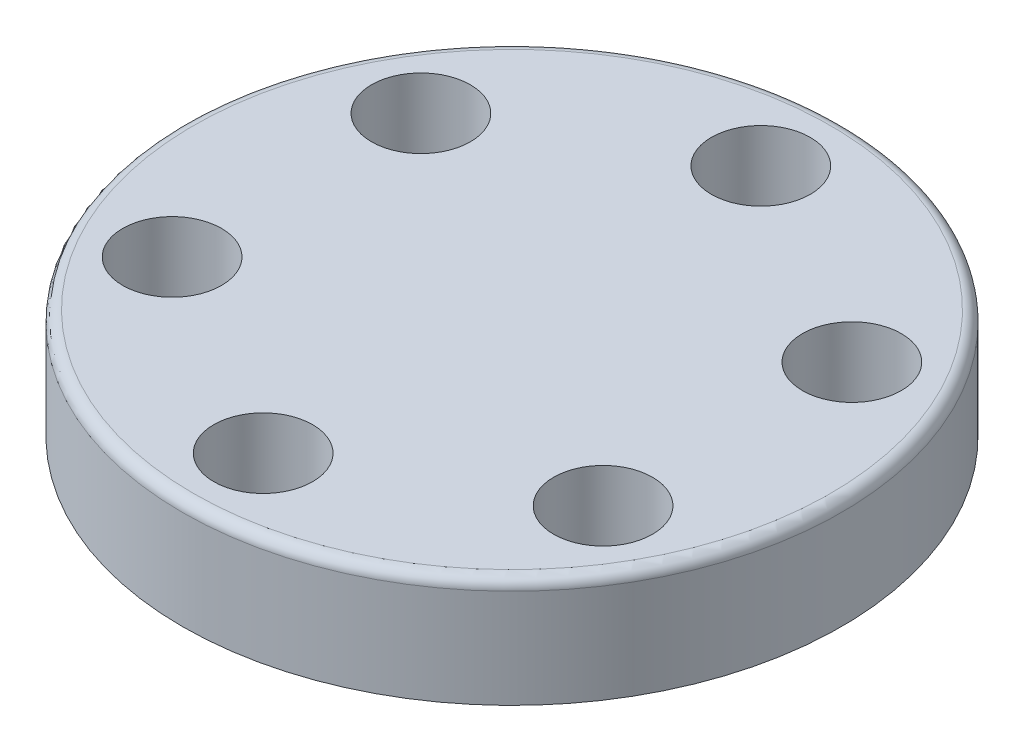
from build123d import *

# Parameters (mm, degrees)
SKETCH_1_R      = 30
SKETCH_1_R_2    = 4.5
EXTRUDE_2_DEPTH = 10
SKETCH_3_R      = 4.5
SKETCH_3_R_2    = 2.5
EXTRUDE_3_DEPTH = 3
FILLET_1_R      = 1


with BuildPart() as part:
    # ｽｹｯﾁ1 → ﾎﾞｽ - 押し出し2 (new body)
    with BuildSketch(Plane(origin=(0, 0, 0), x_dir=(1, 0, 0), z_dir=(0, 1, 0))):
        Circle(SKETCH_1_R)
        with Locations((0, -22.65)):
            Circle(SKETCH_1_R_2, mode=Mode.SUBTRACT)
        with Locations((-19.615475396, -11.325)):
            Circle(SKETCH_1_R_2, mode=Mode.SUBTRACT)
        with Locations((-19.615475396, 11.325)):
            Circle(SKETCH_1_R_2, mode=Mode.SUBTRACT)
        with Locations((0, 22.65)):
            Circle(SKETCH_1_R_2, mode=Mode.SUBTRACT)
        with Locations((19.615475396, 11.325)):
            Circle(SKETCH_1_R_2, mode=Mode.SUBTRACT)
        with Locations((19.615475396, -11.325)):
            Circle(SKETCH_1_R_2, mode=Mode.SUBTRACT)
    extrude(amount=EXTRUDE_2_DEPTH)

    # ｽｹｯﾁ3 → ﾎﾞｽ - 押し出し3 (add)
    # profile 1 of 6: a face of its own
    with BuildSketch(Plane.XZ):
        with Locations((-19.615475396, -11.325)):
            Circle(SKETCH_3_R)
        with Locations((-19.615475396, -11.325)):
            Circle(SKETCH_3_R_2, mode=Mode.SUBTRACT)
    # profile 2 of 6: a face of its own
    with BuildSketch(Plane.XZ):
        with Locations((-19.615475396, 11.325)):
            Circle(SKETCH_3_R)
        with Locations((-19.615475396, 11.325)):
            Circle(SKETCH_3_R_2, mode=Mode.SUBTRACT)
    # profile 3 of 6: a face of its own
    with BuildSketch(Plane.XZ):
        with Locations((0, 22.65)):
            Circle(SKETCH_3_R)
        with Locations((0, 22.65)):
            Circle(SKETCH_3_R_2, mode=Mode.SUBTRACT)
    # profile 4 of 6: a face of its own
    with BuildSketch(Plane.XZ):
        with Locations((19.615475396, 11.325)):
            Circle(SKETCH_3_R)
        with Locations((19.615475396, 11.325)):
            Circle(SKETCH_3_R_2, mode=Mode.SUBTRACT)
    # profile 5 of 6: a face of its own
    with BuildSketch(Plane.XZ):
        with Locations((19.615475396, -11.325)):
            Circle(SKETCH_3_R)
        with Locations((19.615475396, -11.325)):
            Circle(SKETCH_3_R_2, mode=Mode.SUBTRACT)
    # profile 6 of 6: a face of its own
    with BuildSketch(Plane.XZ):
        with Locations((0, -22.65)):
            Circle(SKETCH_3_R)
        with Locations((0, -22.65)):
            Circle(SKETCH_3_R_2, mode=Mode.SUBTRACT)
    extrude(amount=-EXTRUDE_3_DEPTH)

    # ﾌｨﾚｯﾄ1
    fillet_1_edges = [part.edges().sort_by_distance(p)[0] for p in [
        (-30, 10, 0),
    ]]
    fillet(fillet_1_edges, radius=FILLET_1_R)


solid = part.part
